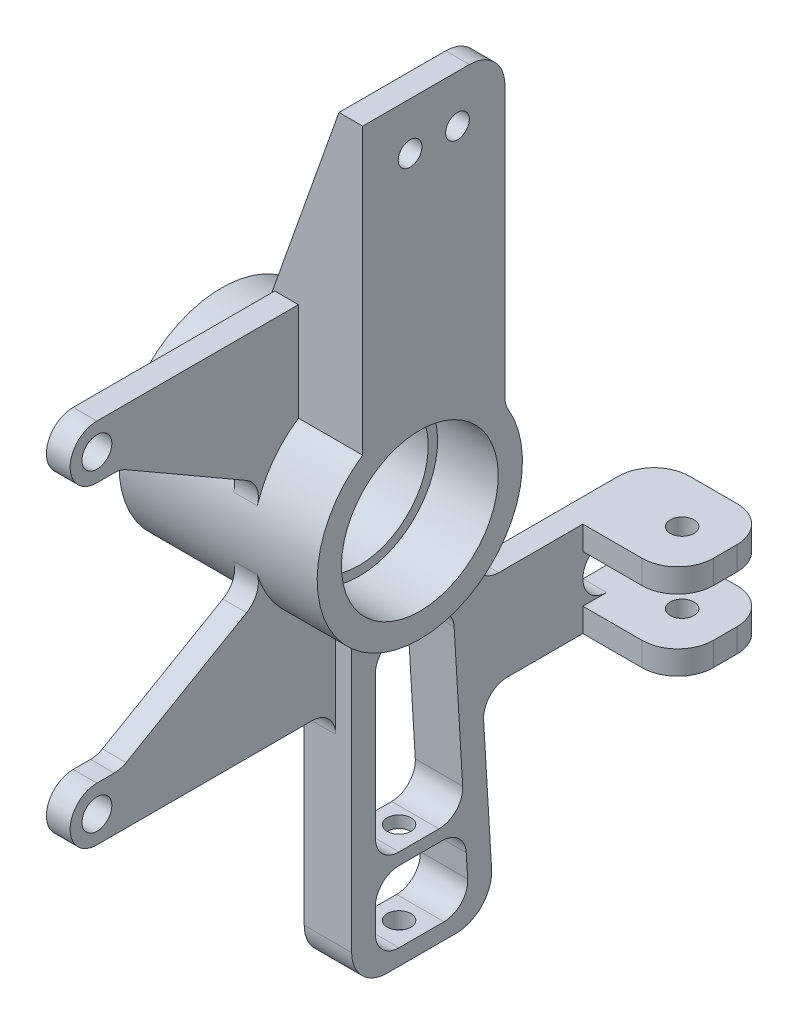
from build123d import *

# Parameters (mm, degrees)
BOSS_EXTRUDE1_START      = -6.35
BOSS_EXTRUDE1_DEPTH      = 6.35
BOSS_EXTRUDE2_DEPTH      = 6.35
BOSS_EXTRUDE2_DEPTH_BACK = 6.35
BOSS_EXTRUDE3_DEPTH      = 6.35
SKETCH6_W                = 25.4
SKETCH6_H                = 6.35
BOSS_EXTRUDE4_DEPTH      = 25.4
BOSS_EXTRUDE5_START      = 25.4
BOSS_EXTRUDE5_DEPTH      = 25.4
BOSS_EXTRUDE6_START      = 6.35
BOSS_EXTRUDE6_DEPTH      = 6.35
BOSS_EXTRUDE7_START      = 6.35
BOSS_EXTRUDE7_DEPTH      = 6.35
CUT_EXTRUDE1_REACH       = 161.579
CUT_EXTRUDE2_REACH       = 147.708
SKETCH14_R               = 3.175
CUT_EXTRUDE3_DEPTH       = 214.767199478
CUT_EXTRUDE4_REACH       = 151.791
SKETCH15_R               = 3.175
SKETCH16_R               = 3.175
CUT_EXTRUDE5_DEPTH       = 171.84284427
F_0_25_FILLET4_R         = 6.35
FILLET1_R                = 9.525


with BuildPart() as part:
    # Sketch1 → Revolve1 (revolve)
    with BuildSketch(Plane.XY, mode=Mode.PRIVATE) as revolve1_sk:
        Polygon((0, 23.5), (16.279070312, 23.5), (16.279070312, 18.5), (36.848222468, 18.5), (36.848222468, 21), (53.090847844, 21), (53.090847844, 27.5), (0, 27.5), align=None)
    revolve(revolve1_sk.sketch.rotate(Axis((0, 0, 0), (1, 0, 0)), 180), axis=Axis((0, 0, 0), (1, 0, 0)))

    # Sketch2 → Boss-Extrude1 (add)
    with BuildSketch(Plane(origin=(53.090847844, 0, 0), x_dir=(0, 0, -1), z_dir=(1, 0, 0)).offset(BOSS_EXTRUDE1_START)):
        with BuildLine():
            Line((22.791687671, 99.207948957), (22.791687671, 15.387948957))
            ThreePointArc((22.791687671, 15.387948957), (5.282335812, 26.987903371), (-15.308312329, 22.84525276))
            Line((-15.308312329, 22.84525276), (-15.308312329, 99.207948957))
            Line((-15.308312329, 99.207948957), (22.791687671, 99.207948957))
        make_face()
    extrude(amount=BOSS_EXTRUDE1_DEPTH)

    # Sketch4 → Boss-Extrude2 (add, two sides: drawn at the far end of the back side and taken through both)
    with BuildSketch(Plane(origin=(33.801584976, 0, 0), x_dir=(0, 0, -1), z_dir=(1, 0, 0)).offset(-BOSS_EXTRUDE2_DEPTH_BACK)):
        with BuildLine():
            Line((26.425369625, -7.612479241), (32.775369625, -113.538))
            Line((32.775369625, -113.538), (-5.324630375, -113.538))
            Line((-5.324630375, -113.538), (-5.324630375, -26.979590645))
            ThreePointArc((-5.324630375, -26.979590645), (14.320668639, -23.476977015), (26.425369625, -7.612479241))
        make_face()
    extrude(amount=BOSS_EXTRUDE2_DEPTH + BOSS_EXTRUDE2_DEPTH_BACK)

    # Sketch5 → Boss-Extrude3 (add)
    with BuildSketch(Plane(origin=(40.151584976, 0, 0), x_dir=(0, 0, -1), z_dir=(1, 0, 0))):
        Polygon((29.623435156, -60.96), (82.023576364, -60.96), (82.023576364, -54.61), (56.623576364, -54.61), (56.623576364, -41.91), (82.023576364, -41.91), (82.023576364, -35.56), (28.1007615, -35.56), align=None)
    extrude(amount=-BOSS_EXTRUDE3_DEPTH)

    # Sketch6 → Boss-Extrude4 (add)
    with BuildSketch(Plane(origin=(40.151584976, 0, 0), x_dir=(0, 0, -1), z_dir=(1, 0, 0))):
        with Locations((69.323576364, -38.735)):
            Rectangle(SKETCH6_W, SKETCH6_H)
        with Locations((69.323576364, -57.785)):
            Rectangle(SKETCH6_W, SKETCH6_H)
    extrude(amount=BOSS_EXTRUDE4_DEPTH)

    # Sketch7 → Boss-Extrude5 (add)
    with BuildSketch(Plane.ZY.offset(-46.740847844).offset(BOSS_EXTRUDE5_START)):
        with BuildLine():
            Line((15.308312329, 22.84525276), (15.308312329, 99.207948957))
            Line((15.308312329, 99.207948957), (8.958312329, 99.207948957))
            Line((8.958312329, 99.207948957), (8.958312329, 25.99997385))
            ThreePointArc((8.958312329, 25.99997385), (12.235413126, 24.62812753), (15.308312329, 22.84525276))
        make_face()
    extrude(amount=-BOSS_EXTRUDE5_DEPTH)

    # Sketch8 → Boss-Extrude6 (add)
    with BuildSketch(Plane.ZY.offset(-35.879535156).offset(BOSS_EXTRUDE6_START)):
        with BuildLine():
            Line((15.308312329, 49.175), (69.3, 49.175))
            ThreePointArc((69.3, 49.175), (76.475, 42), (69.3, 34.825))
            Line((69.3, 34.825), (62.95, 34.825))
            Line((62.95, 34.825), (24.446259855, 12.594855263))
            ThreePointArc((24.446259855, 12.594855263), (20.527400337, 18.299612985), (15.308312329, 22.84525276))
            Line((15.308312329, 22.84525276), (15.308312329, 49.175))
        make_face()
        with BuildLine():
            ThreePointArc((69.3, 38.000000001), (73.299999999, 42), (69.3, 46.000000001))
            ThreePointArc((69.3, 46.000000001), (65.299999999, 42), (69.3, 38.000000001))
        make_face(mode=Mode.SUBTRACT)
    extrude(amount=-BOSS_EXTRUDE6_DEPTH)

    # Sketch9 → Boss-Extrude7 (add)
    with BuildSketch(Plane.ZY.offset(-35.879535156).offset(BOSS_EXTRUDE7_START)):
        with BuildLine():
            Line((5.324630375, -49.174999998), (69.3, -49.174999998))
            ThreePointArc((69.3, -49.174999998), (76.474999998, -42), (69.3, -34.825000002))
            Line((69.3, -34.825000002), (62.95, -34.825000002))
            Line((62.95, -34.825000002), (24.446259854, -12.594855264))
            ThreePointArc((24.446259854, -12.594855264), (16.531988061, -21.975972578), (5.324630375, -26.979590645))
            Line((5.324630375, -26.979590645), (5.324630375, -49.174999998))
        make_face()
        with BuildLine():
            ThreePointArc((69.3, -46.000000001), (73.300000001, -42), (69.3, -38.000000001))
            ThreePointArc((69.3, -38.000000001), (65.300000001, -42), (69.3, -46.000000001))
        make_face(mode=Mode.SUBTRACT)
    extrude(amount=-BOSS_EXTRUDE7_DEPTH)

    # Sketch10 → Cut-Extrude1 (cut, up to next)
    with BuildSketch(Plane(origin=(0, 0, 8.958312329), x_dir=(-1, 0, 0), z_dir=(0, 0, -1)), mode=Mode.PRIVATE) as cut_extrude1_sk1:
        Polygon((-46.740847844, 99.207948957), (-21.340847844, 27.5), (-21.340847844, 99.207948957), align=None)
    cut_extrude1_tool1 = extrude(cut_extrude1_sk1.sketch, amount=-CUT_EXTRUDE1_REACH, mode=Mode.PRIVATE) & part.part
    add(cut_extrude1_tool1.solids().sort_by_distance((29.807515, 75.305299, 8.958312))[0], mode=Mode.SUBTRACT)

    # Sketch13 → Cut-Extrude2 (cut, up to next)
    with BuildSketch(Plane(origin=(40.151584976, 0, 0), x_dir=(0, 0, -1), z_dir=(1, 0, 0)), mode=Mode.PRIVATE) as cut_extrude2_sk1:
        Polygon((26.155115223, -109.22), (25.01310998, -90.17), (1.025369625, -90.17), (1.025369625, -109.22), align=None)
    cut_extrude2_tool1 = extrude(cut_extrude2_sk1.sketch, amount=-CUT_EXTRUDE2_REACH, mode=Mode.PRIVATE) & part.part
    # Sketch13 → Cut-Extrude2 (cut, up to next)
    with BuildSketch(Plane(origin=(40.151584976, 0, 0), x_dir=(0, 0, -1), z_dir=(1, 0, 0)), mode=Mode.PRIVATE) as cut_extrude2_sk2:
        Polygon((21.77742846, -36.195), (24.822775773, -86.995), (1.025369625, -86.995), (1.025369625, -36.195), align=None)
    cut_extrude2_tool2 = extrude(cut_extrude2_sk2.sketch, amount=-CUT_EXTRUDE2_REACH, mode=Mode.PRIVATE) & part.part
    add(cut_extrude2_tool1.solids().sort_by_distance((40.151585, -99.76882, -13.306954))[0], mode=Mode.SUBTRACT)
    add(cut_extrude2_tool2.solids().sort_by_distance((40.151585, -62.173771, -12.180084))[0], mode=Mode.SUBTRACT)

    # Sketch14 → Cut-Extrude3 (cut, through all)
    with BuildSketch(Plane(origin=(0, -86.995, 0), x_dir=(1, 0, 0), z_dir=(0, 1, 0))):
        with Locations(Location((33.801584976, 13.725369625, 0), (0, 0, 180))):
            Circle(SKETCH14_R)
    extrude(amount=-CUT_EXTRUDE3_DEPTH, mode=Mode.SUBTRACT)

    # Sketch15 → Cut-Extrude4 (cut, up to next)
    with BuildSketch(Plane(origin=(53.090847844, 0, 0), x_dir=(0, 0, -1), z_dir=(1, 0, 0)), mode=Mode.PRIVATE) as cut_extrude4_sk1:
        with Locations(Location((-2.608312329, 86.507948957, 0), (0, 0, 90))):
            Circle(SKETCH15_R)
    cut_extrude4_tool1 = extrude(cut_extrude4_sk1.sketch, amount=-CUT_EXTRUDE4_REACH, mode=Mode.PRIVATE) & part.part
    # Sketch15 → Cut-Extrude4 (cut, up to next)
    with BuildSketch(Plane(origin=(53.090847844, 0, 0), x_dir=(0, 0, -1), z_dir=(1, 0, 0)), mode=Mode.PRIVATE) as cut_extrude4_sk2:
        with Locations(Location((10.091687671, 86.507948957, 0), (0, 0, 90))):
            Circle(SKETCH15_R)
    cut_extrude4_tool2 = extrude(cut_extrude4_sk2.sketch, amount=-CUT_EXTRUDE4_REACH, mode=Mode.PRIVATE) & part.part
    add(cut_extrude4_tool1.solids().sort_by_distance((53.090848, 86.507949, 2.608312))[0], mode=Mode.SUBTRACT)
    add(cut_extrude4_tool2.solids().sort_by_distance((53.090848, 86.507949, -10.091688))[0], mode=Mode.SUBTRACT)

    # Sketch16 → Cut-Extrude5 (cut, through all)
    with BuildSketch(Plane(origin=(0, -35.56, 0), x_dir=(1, 0, 0), z_dir=(0, 1, 0))):
        with Locations(Location((54.032981596, 69.323576364, 0), (0, 0, 180))):
            Circle(SKETCH16_R)
    extrude(amount=-CUT_EXTRUDE5_DEPTH, mode=Mode.SUBTRACT)

    # 0.25 Fillet4
    # the kernel refuses this fillet: 6.35 mm, written as the material it adds along each edge
    with BuildSketch(Plane(origin=(29.529535156, -34.825000002, 62.95), x_dir=(0, 0.49999999999999617, -0.8660254037844408), z_dir=(1, 0, 0))) as f_0_25_fillet4_piece_1:
        with BuildLine():
            CenterArc((F_0_25_FILLET4_R * 0.267949192431, F_0_25_FILLET4_R), F_0_25_FILLET4_R, 240, 30)
            Line((-F_0_25_FILLET4_R * 0.232050807569, F_0_25_FILLET4_R * 0.133974596216), (0, 0))
            Line((0, 0), (F_0_25_FILLET4_R * 0.267949192431, 0))
        make_face()
    extrude(amount=6.35)
    with BuildSketch(Plane(origin=(29.529535156, 34.825, 62.95), x_dir=(0, -0.49999999999999967, -0.8660254037844389), z_dir=(1, 0, 0))) as f_0_25_fillet4_piece_2:
        with BuildLine():
            CenterArc((F_0_25_FILLET4_R * 0.267949192431, -F_0_25_FILLET4_R), F_0_25_FILLET4_R, 90, 30)
            Line((-F_0_25_FILLET4_R * 0.232050807569, -F_0_25_FILLET4_R * 0.133974596216), (0, 0))
            Line((0, 0), (F_0_25_FILLET4_R * 0.267949192431, 0))
        make_face()
    extrude(amount=6.35)
    with BuildSketch(Plane(origin=(29.529535156, 22.84525276, 15.308312329), x_dir=(0, -0.5990573223008338, 0.800706141226452), z_dir=(-1, 0, 0))) as f_0_25_fillet4_piece_3:
        with BuildLine():
            CenterArc((3.186086766, 6.341431143), F_0_25_FILLET4_R, 216.80241312, 50.220708616)
            Line((-1.898397231, 2.537417146), (0, 0))
            ThreePointArc((0, 0), (1.428156252, 0.037109225), (2.856312504, 0))
        make_face()
    extrude(amount=8.188687312)
    with BuildSketch(Plane(origin=(40.151584976, -54.61, -56.623576364), x_dir=(0, 1, 0), z_dir=(-1, 0, 0))) as f_0_25_fillet4_piece_4:
        with BuildLine():
            CenterArc((F_0_25_FILLET4_R, F_0_25_FILLET4_R), F_0_25_FILLET4_R, 180, 90)
            Line((0, F_0_25_FILLET4_R), (0, 0))
            Line((0, 0), (F_0_25_FILLET4_R, 0))
        make_face()
    extrude(amount=6.35)
    with BuildSketch(Plane(origin=(40.151584976, -41.91, -56.623576364), x_dir=(0, -1, 0), z_dir=(-1, 0, 0)), Plane(origin=(29.529535156, -49.174999998, 5.324630375), x_dir=(0, -1, 0), z_dir=(1, 0, 0))) as f_0_25_fillet4_piece_5:
        with BuildLine():
            CenterArc((F_0_25_FILLET4_R, -F_0_25_FILLET4_R), F_0_25_FILLET4_R, 90, 90)
            Line((0, -F_0_25_FILLET4_R), (0, 0))
            Line((0, 0), (F_0_25_FILLET4_R, 0))
        make_face()
    extrude(amount=6.35)
    with BuildSketch(Plane(origin=(40.151584976, -109.22, -1.025369625), x_dir=(0, 0, -1), z_dir=(-1, 0, 0)), Plane(origin=(40.151584976, -90.17, -1.025369625), x_dir=(0, -1, 0), z_dir=(-1, 0, 0)), Plane(origin=(40.151584976, -86.995, -1.025369625), x_dir=(0, 0, -1), z_dir=(-1, 0, 0)), Plane(origin=(40.151584976, -36.195, -1.025369625), x_dir=(0, -1, 0), z_dir=(-1, 0, 0))) as f_0_25_fillet4_piece_6:
        with BuildLine():
            CenterArc((F_0_25_FILLET4_R, -F_0_25_FILLET4_R), F_0_25_FILLET4_R, 90, 90)
            Line((0, -F_0_25_FILLET4_R), (0, 0))
            Line((0, 0), (F_0_25_FILLET4_R, 0))
        make_face()
    extrude(amount=12.7)
    with BuildSketch(Plane(origin=(40.151584976, -109.22, -26.155115223), x_dir=(0, 0, 1), z_dir=(-1, 0, 0))) as f_0_25_fillet4_piece_7:
        with BuildLine():
            CenterArc((F_0_25_FILLET4_R * 1.06174303854, F_0_25_FILLET4_R), F_0_25_FILLET4_R, 176.5693508, 93.4306492)
            Line((F_0_25_FILLET4_R * 0.063535078166, F_0_25_FILLET4_R * 1.05984035295), (0, 0))
            Line((0, 0), (F_0_25_FILLET4_R * 1.06174303854, 0))
        make_face()
    extrude(amount=12.7)
    with BuildSketch(Plane(origin=(40.151584976, -90.17, -25.01310998), x_dir=(0, 0, 1), z_dir=(-1, 0, 0))) as f_0_25_fillet4_piece_8:
        with BuildLine():
            CenterArc((F_0_25_FILLET4_R * 0.941847475047, -F_0_25_FILLET4_R), F_0_25_FILLET4_R, 90, 86.5693508)
            Line((-F_0_25_FILLET4_R * 0.0563604853296, -F_0_25_FILLET4_R * 0.940159647052), (0, 0))
            Line((0, 0), (F_0_25_FILLET4_R * 0.941847475047, 0))
        make_face()
    extrude(amount=12.7)
    with BuildSketch(Plane(origin=(40.151584976, -86.995, -24.822775773), x_dir=(0, 0.9982079603765488, 0.05984035294757458), z_dir=(-1, 0, 0))) as f_0_25_fillet4_piece_9:
        with BuildLine():
            CenterArc((F_0_25_FILLET4_R * 1.06174303854, -F_0_25_FILLET4_R), F_0_25_FILLET4_R, 90, 93.4306492)
            Line((F_0_25_FILLET4_R * 0.063535078166, -F_0_25_FILLET4_R * 1.05984035295), (0, 0))
            Line((0, 0), (F_0_25_FILLET4_R * 1.06174303854, 0))
        make_face()
    extrude(amount=12.7)
    with BuildSketch(Plane(origin=(27.451584976, -7.612479241, -26.425369625), x_dir=(0, 0.9654712583471952, -0.26050959541921553), z_dir=(1, 0, 0))) as f_0_25_fillet4_piece_10:
        with BuildLine():
            CenterArc((1.038638906, -6.34908993), F_0_25_FILLET4_R, 90.970048392, 17.560902681)
            Line((-0.979498363, -0.328324035), (0, 0))
            ThreePointArc((0, 0), (0.465567562, -0.003941249), (0.931135124, 0))
        make_face()
    extrude(amount=12.7)
    with BuildSketch(Plane(origin=(40.151584976, -36.195, -21.77742846), x_dir=(0, -0.9982079603765489, -0.05984035294757416), z_dir=(-1, 0, 0))) as f_0_25_fillet4_piece_11:
        with BuildLine():
            CenterArc((F_0_25_FILLET4_R * 0.941847475047, F_0_25_FILLET4_R), F_0_25_FILLET4_R, 183.4306492, 86.5693508)
            Line((-F_0_25_FILLET4_R * 0.0563604853296, F_0_25_FILLET4_R * 0.940159647052), (0, 0))
            Line((0, 0), (F_0_25_FILLET4_R * 0.941847475047, 0))
        make_face()
    extrude(amount=12.7)
    with BuildSketch(Plane(origin=(40.151584976, -60.96, -29.623435156), x_dir=(0, -0.9982079603765488, -0.05984035294757458), z_dir=(-1, 0, 0))) as f_0_25_fillet4_piece_12:
        with BuildLine():
            CenterArc((F_0_25_FILLET4_R * 1.06174303854, -F_0_25_FILLET4_R), F_0_25_FILLET4_R, 90, 93.4306492)
            Line((F_0_25_FILLET4_R * 0.063535078166, -F_0_25_FILLET4_R * 1.05984035295), (0, 0))
            Line((0, 0), (F_0_25_FILLET4_R * 1.06174303854, 0))
        make_face()
    extrude(amount=6.35)
    with BuildSketch(Plane(origin=(40.151584976, -35.56, -28.1007615), x_dir=(0, 0.9982079603765489, 0.05984035294757479), z_dir=(-1, 0, 0))) as f_0_25_fillet4_piece_13:
        with BuildLine():
            CenterArc((F_0_25_FILLET4_R * 0.941847475047, F_0_25_FILLET4_R), F_0_25_FILLET4_R, 183.4306492, 86.5693508)
            Line((-F_0_25_FILLET4_R * 0.0563604853296, F_0_25_FILLET4_R * 0.940159647052), (0, 0))
            Line((0, 0), (F_0_25_FILLET4_R * 0.941847475047, 0))
        make_face()
    extrude(amount=6.35)
    with BuildSketch(Plane(origin=(29.529535156, -12.594855264, 24.446259854), x_dir=(0, 0.9266302092084975, 0.3759740089184572), z_dir=(1, 0, 0))) as f_0_25_fillet4_piece_14:
        with BuildLine():
            CenterArc((5.531795753, 6.32413382), F_0_25_FILLET4_R, 187.91547467, 76.911263612)
            Line((-0.757703387, 5.449662228), (0, 0))
            ThreePointArc((0, 0), (2.479615048, 0.112018891), (4.959230096, 0))
        make_face()
    extrude(amount=6.35)
    with BuildSketch(Plane(origin=(29.529535156, 12.594855263, 24.446259855), x_dir=(0, -0.9266302092337214, 0.3759740088562898), z_dir=(1, 0, 0))) as f_0_25_fillet4_piece_15:
        with BuildLine():
            CenterArc((5.531795752, -6.32413382), F_0_25_FILLET4_R, 95.173261718, 76.911263608)
            Line((-0.757703388, -5.449662227), (0, 0))
            ThreePointArc((0, 0), (2.479615048, -0.112018891), (4.959230096, 0))
        make_face()
    extrude(amount=6.35)
    with BuildSketch(Plane(origin=(21.340847844, 25.99997385, 8.958312329), x_dir=(0, 0.20304997506833786, -0.9791683755232026), z_dir=(1, 0, 0))) as f_0_25_fillet4_piece_16_section:
        with BuildLine():
            CenterArc((7.791231567, 6.298585148), F_0_25_FILLET4_R, 168.284629793, 94.419307905)
            Line((1.573512383, 7.587952489), (0, 0))
            ThreePointArc((0, 0), (3.492402088, 0.222662746), (6.984804176, 0))
        make_face()
    f_0_25_fillet4_piece_16 = extrude(amount=44.773461907, mode=Mode.PRIVATE)
    f_0_25_fillet4_piece_16 = split(f_0_25_fillet4_piece_16, bisect_by=Plane(origin=(53.090847844, 28.245025777, 7.377553375), z_dir=(-1, 0, 0)), keep=Keep.TOP, mode=Mode.PRIVATE)
    f_0_25_fillet4_piece_16 = split(f_0_25_fillet4_piece_16, bisect_by=Plane(origin=(23.009046409, 32.20957077, 7.377553375), z_dir=(0.9426130158079032, -0.33388726005873554, 0)), keep=Keep.TOP, mode=Mode.PRIVATE)
    add(f_0_25_fillet4_piece_16)
    with BuildSketch(Plane(origin=(46.740847844, 15.387948957, -22.791687671), x_dir=(0, -0.845229325073702, -0.5344037687324578), z_dir=(1, 0, 0))) as f_0_25_fillet4_piece_17:
        with BuildLine():
            CenterArc((1.843582945, 6.347132271), F_0_25_FILLET4_R, 237.696514491, 30.581473676)
            Line((-1.549880986, 0.979926057), (0, 0))
            ThreePointArc((0, 0), (0.826381923, 0.012419297), (1.652763847, 0))
        make_face()
    extrude(amount=6.35)
    with BuildSketch(Plane(origin=(35.879535156, -26.979590645, 5.324630375), x_dir=(0, 0.27009263265411193, 0.9628343418189709), z_dir=(1, 0, 0))) as f_0_25_fillet4_piece_18:
        with BuildLine():
            CenterArc((4.819325117, 6.330377308), F_0_25_FILLET4_R, 195.669779106, 69.824731579)
            Line((-1.294672953, 4.61528909), (0, 0))
            ThreePointArc((0, 0), (2.160251683, 0.084980163), (4.320503365, 0))
        make_face()
    extrude(amount=4.27204982)

    # Fillet1
    fillet1_edges = [part.edges().sort_by_distance(p)[0] for p in [
        (49.915847844, 99.207948957, -22.791687671),
        (33.801584976, -113.538, 5.324630375),
        (33.801584976, -113.538, -32.775369625),
        (33.801584976, -38.735, -82.023576364),
        (33.801584976, -57.785, -82.023576364),
        (65.551584976, -38.735, -82.023576364),
        (65.551584976, -38.735, -56.623576364),
        (65.551584976, -57.785, -82.023576364),
        (65.551584976, -57.785, -56.623576364),
    ]]
    fillet(fillet1_edges, radius=FILLET1_R)


solid = part.part
